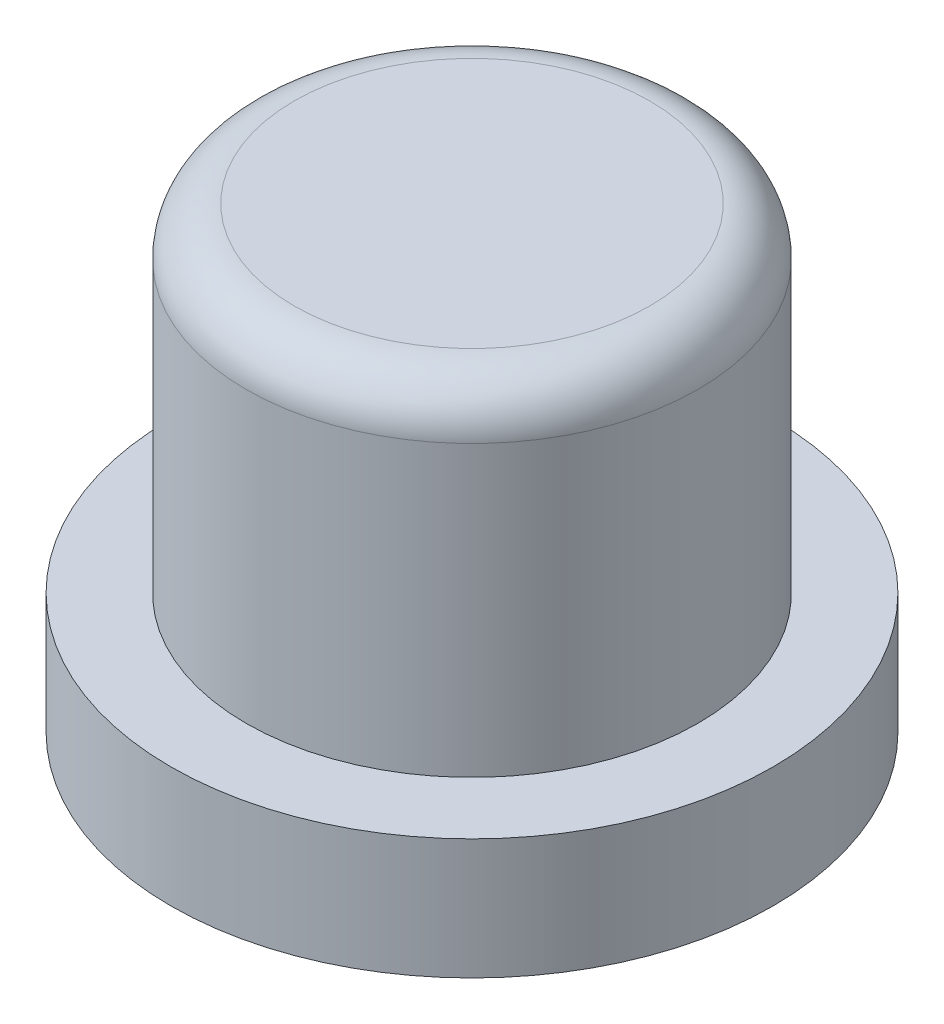
from build123d import *

# Parameters (mm, degrees)
EXTRUDE_1_DEPTH      = 3
EXTRUDE_1_DEPTH_BACK = 2.6
SKETCH_1_R           = 3.75
SKETCH_2_R           = 5
EXTRUDE_2_DEPTH      = 2
FILLET_1_R           = 0.8
SKETCH_3_R           = 1.905870149
SKETCH_4_R           = 1.852192046


# Read off the part's stored shape, not the designer's step: Отступ5
with BuildPart() as part:
    # Эскиз1 → Бобышка-Вытянуть1 (new, two sides: drawn at the far end of the back side and taken through both)
    with BuildSketch(Plane(origin=(0, 0, 0), x_dir=(1, 0, 0), z_dir=(0, 1, 0)).offset(-EXTRUDE_1_DEPTH_BACK)):
        with Locations(Location((0, 0, 0), (0, 0, 270))):
            Circle(SKETCH_1_R)
    extrude(amount=EXTRUDE_1_DEPTH + EXTRUDE_1_DEPTH_BACK)

    # Эскиз2 → Бобышка-Вытянуть2 (add)
    with BuildSketch(Plane.XZ.offset(2.6)):
        with Locations(Location((0, 0, 0), (0, 0, 270))):
            Circle(SKETCH_2_R)
    extrude(amount=EXTRUDE_2_DEPTH)

    # Скругление1
    fillet_1_edges = [part.edges().sort_by_distance(p)[0] for p in [
        (0, 3, -3.75),
    ]]
    fillet(fillet_1_edges, radius=FILLET_1_R)

    # Отступ5 outline → Отступ5 (revolve, cut)
    with BuildSketch(Plane.XY):
        with BuildLine():
            Line((1.605870149, -4.6), (1.552192046, -1.524783544))
            ThreePointArc((1.552192046, -1.524783544), (1.514226865, -1.436417193), (1.425211389, -1.4))
            Line((1.425211389, -1.4), (0, -1.4))
            Line((0, -1.4), (0, -4.6))
            Line((0, -4.6), (1.605870149, -4.6))
        make_face()
    revolve(axis=Axis((0, 0, 0), (0, 1, 0)), mode=Mode.SUBTRACT)

    # Эскиз3 → Вырез-По сечениям1 section 0
    with BuildSketch(Plane.XZ.offset(4.6)):
        Circle(SKETCH_3_R)
    # Эскиз4 → Вырез-По сечениям1 section 1
    with BuildSketch(Plane.XZ.offset(1.4)):
        Circle(SKETCH_4_R)
    loft(mode=Mode.SUBTRACT)


solid = part.part
